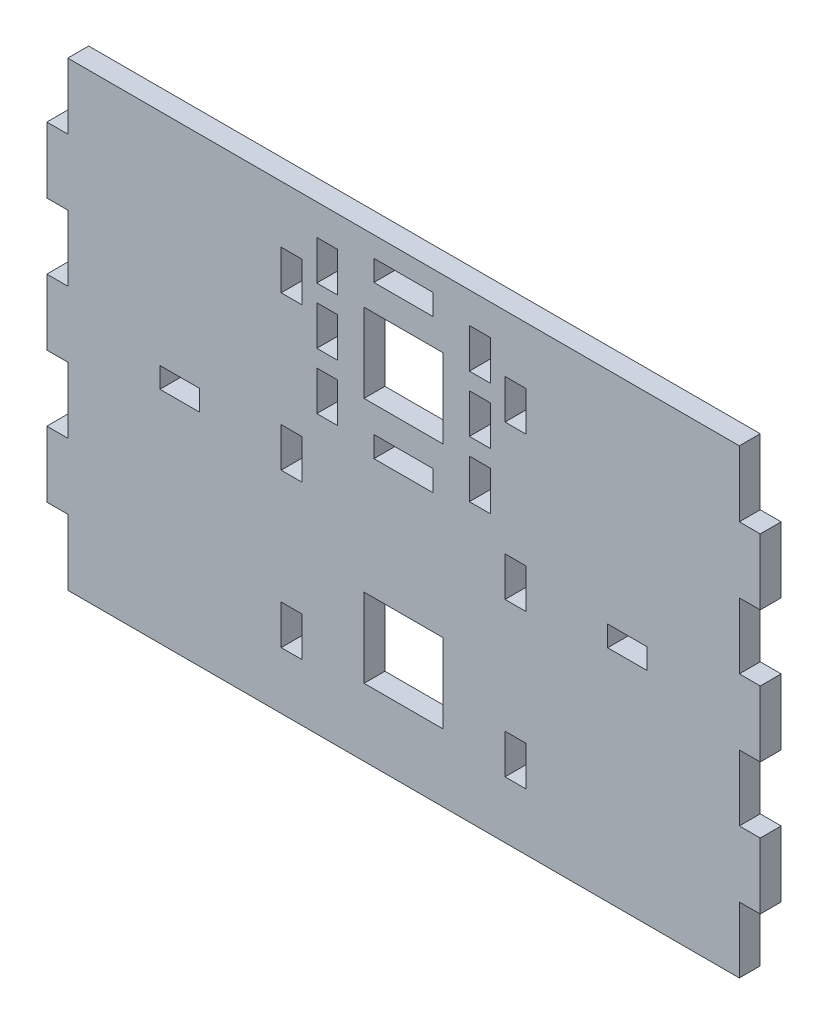
from build123d import *

# Parameters (mm, degrees)
SKETCH1_W           = 12
SKETCH1_H           = 12
SKETCH1_W_2         = 9
SKETCH1_H_2         = 3.175
SKETCH1_W_3         = 3.175
SKETCH1_H_3         = 6
SKETCH1_W_4         = 6
SKETCH1_H_4         = 3.125
BOSS_EXTRUDE1_DEPTH = 1.5875


with BuildPart() as part:
    # Sketch1 → Boss-Extrude1 (new, symmetric)
    with BuildSketch(Plane.XY):
        Polygon((54.175, 0), (54.175, 5), (51, 5), (51, 15), (54.175, 15), (54.175, 25), (51, 25), (51, 35), (-51, 35), (-51, 25), (-54.175, 25), (-54.175, 15), (-51, 15), (-51, 5), (-54.175, 5), (-54.175, -5), (-51, -5), (-51, -15), (-54.175, -15), (-54.175, -25), (-51, -25), (-51, -35), (51, -35), (51, -25), (54.175, -25), (54.175, -15), (51, -15), (51, -5), (54.175, -5), align=None)
        with Locations((0, -18.7375)):
            Rectangle(SKETCH1_W, SKETCH1_H, mode=Mode.SUBTRACT)
        with Locations((0, 7.15)):
            Rectangle(SKETCH1_W_2, SKETCH1_H_2, mode=Mode.SUBTRACT)
        with Locations((0, 18.7375)):
            Rectangle(SKETCH1_W, SKETCH1_H, mode=Mode.SUBTRACT)
        with Locations((0, 30.325)):
            Rectangle(SKETCH1_W_2, SKETCH1_H_2, mode=Mode.SUBTRACT)
        with Locations((17, -23.333333333)):
            Rectangle(SKETCH1_W_3, SKETCH1_H_3, mode=Mode.SUBTRACT)
        with Locations((17, 0)):
            Rectangle(SKETCH1_W_3, SKETCH1_H_3, mode=Mode.SUBTRACT)
        with Locations((11.5875, 10.15)):
            Rectangle(SKETCH1_W_3, SKETCH1_H_3, mode=Mode.SUBTRACT)
        Polygon((37, 1.5625), (37, 0), (37, -1.5625), (31, -1.5625), (31, 1.5625), align=None, mode=Mode.SUBTRACT)
        with Locations((11.5875, 18.7375)):
            Rectangle(SKETCH1_W_3, SKETCH1_H_3, mode=Mode.SUBTRACT)
        with Locations((17, 23.333333333)):
            Rectangle(SKETCH1_W_3, SKETCH1_H_3, mode=Mode.SUBTRACT)
        with Locations((11.5875, 27.325)):
            Rectangle(SKETCH1_W_3, SKETCH1_H_3, mode=Mode.SUBTRACT)
        with Locations((-11.5875, 27.325)):
            Rectangle(SKETCH1_W_3, SKETCH1_H_3, mode=Mode.SUBTRACT)
        with Locations((-17, -23.333333333)):
            Rectangle(SKETCH1_W_3, SKETCH1_H_3, mode=Mode.SUBTRACT)
        with Locations((-34, 0)):
            Rectangle(SKETCH1_W_4, SKETCH1_H_4, mode=Mode.SUBTRACT)
        with Locations((-17, 0)):
            Rectangle(SKETCH1_W_3, SKETCH1_H_3, mode=Mode.SUBTRACT)
        with Locations((-11.5875, 10.15)):
            Rectangle(SKETCH1_W_3, SKETCH1_H_3, mode=Mode.SUBTRACT)
        with Locations((-17, 23.333333333)):
            Rectangle(SKETCH1_W_3, SKETCH1_H_3, mode=Mode.SUBTRACT)
        with Locations((-11.5875, 18.7375)):
            Rectangle(SKETCH1_W_3, SKETCH1_H_3, mode=Mode.SUBTRACT)
    extrude(amount=BOSS_EXTRUDE1_DEPTH, both=True)


solid = part.part
